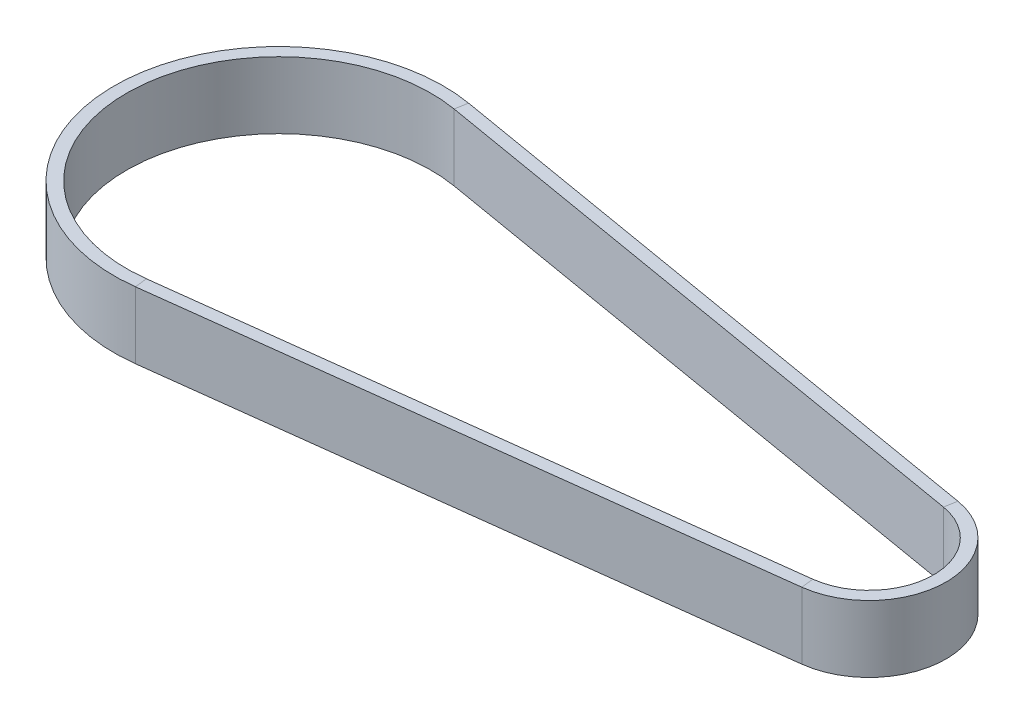
from build123d import *

# Parameters (mm, degrees)
SKETCH2_W = 3
SKETCH2_H = 16


with BuildPart() as part:
    # Sweep1: sweep along a path in Sketch1
    with BuildLine(Plane(origin=(0, 0, 0), x_dir=(1, 0, 0), z_dir=(0, 1, 0))) as sweep1_path:
        Line((256.110089299, 4211.172998744), (397.556812308, 4187.155826761))
        ThreePointArc((397.556812308, 4187.155826761), (411.706562996, 4170.007234672), (396.788044351, 4153.523076926))
        Line((396.788044351, 4153.523076926), (254.391666807, 4135.993910877))
        ThreePointArc((254.391666807, 4135.993910877), (211.758790065, 4174.577584752), (256.110089299, 4211.172998744))
    # Sketch2 → Sweep1 (sweep)
    with BuildSketch(Plane(origin=(254.391666807, 0, -4135.993910877), x_dir=(0.12217894433971865, 0, 0.9925080884103826), z_dir=(-0.9925080884103826, 0, 0.12217894433971865))):
        Rectangle(SKETCH2_W, SKETCH2_H)
    sweep(path=sweep1_path.line)


solid = part.part
